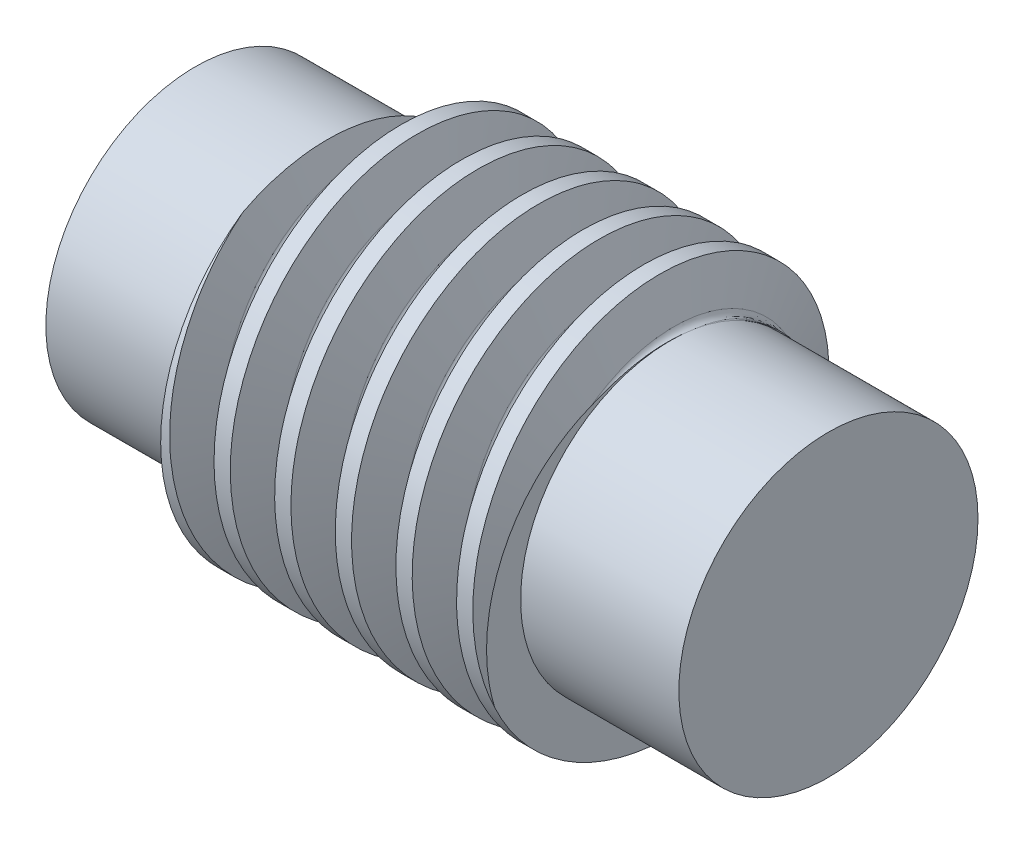
from build123d import *

# Parameters (mm, degrees)
SKETCH_1_W      = 16.4
SKETCH_1_H      = 10
SWEEP_1_PITCH   = 3.141592654
SKETCH_4_R      = 7.75
EXTRUDE_1_DEPTH = 8.2
EXTRUDE_START   = 8.2
SKETCH_5_R      = 7.75
EXTRUDE_2_DEPTH = 8.2


with BuildPart() as part:
    # 草图1 → 旋转1 (revolve)
    with BuildSketch(Plane.XY, mode=Mode.PRIVATE) as revolve_1_sk:
        with Locations((8.2, 5)):
            Rectangle(SKETCH_1_W, SKETCH_1_H)
    revolve(revolve_1_sk.sketch.rotate(Axis((-56.849408284, 0, 0), (1, 0, 0)), 90), axis=Axis((-56.849408284, 0, 0), (1, 0, 0)))

    # 切除-扫描1: the profile of 草图3 profile screwed along a right-hand helix of 10.440564 turns, 10 arcs to a turn; built about Z, then put on its axis
    sweep_1_z = Axis((0, 0, 0), (0, 0, 1))
    sweep_1_corners = [(10.0003, 0, -3.448214384), (10.0003, 0, -1.149259207), (8.000032346, 0, -1.877297093), (7.75, 0, -2.234380289), (7.75, 0, -2.363093301), (8.000032346, 0, -2.720176497)]
    with BuildLine(mode=Mode.PRIVATE) as sweep_1_profile:
        Line(sweep_1_corners[0], sweep_1_corners[1])
        Line(sweep_1_corners[1], sweep_1_corners[2])
        Line(sweep_1_corners[3], sweep_1_corners[4])
        Line(sweep_1_corners[5], sweep_1_corners[0])
        ThreePointArc((8.000032346, 0, -1.877297093), (7.818722223, 0, -2.016421243), (7.75, 0, -2.234380289))
        ThreePointArc((7.75, 0, -2.363093301), (7.818722223, 0, -2.581052347), (8.000032346, 0, -2.720176497))
    sweep_1_cap = Face(sweep_1_profile.wire())
    sweep_1_arcs = [((8.000032346, 0, -1.877297093), (7.75, 0, -1.968301425), (7.75, 0, -2.234380289), (1, 0.8191520442889914, 1)), ((7.75, 0, -2.363093301), (7.75, 0, -2.629172166), (8.000032346, 0, -2.720176497), (1, 0.8191520442889898, 1))]  # start, shoulder, end, weights
    sweep_1_turn_angles = [0, 18, 36, 54, 72, 90, 108, 126, 144, 162, 180, 198, 216, 234, 252, 270, 288, 306, 324, 342, 360]
    sweep_1_turn_weights = [1, 0.9510565162951535, 1, 0.9510565162951535, 1, 0.9510565162951535, 1, 0.9510565162951535, 1, 0.9510565162951535, 1, 0.9510565162951535, 1, 0.9510565162951535, 1, 0.9510565162951535, 1, 0.9510565162951535, 1, 0.9510565162951535, 1]
    sweep_1_turn_rails = [Edge.make_bspline([Vector(p[0], p[1], 0).rotate(sweep_1_z, sweep_1_turn_angles[k]) / sweep_1_turn_weights[k] + Vector(0, 0, p[2] + SWEEP_1_PITCH * sweep_1_turn_angles[k] / 360) for k in range(21)], [0, 0, 0, 1, 1, 2, 2, 3, 3, 4, 4, 5, 5, 6, 6, 7, 7, 8, 8, 9, 9, 10, 10, 10], 2, sweep_1_turn_weights) for p in sweep_1_corners]
    sweep_1_turn_sides = [*[Face.make_surface_from_curves(sweep_1_turn_rails[p[0]], sweep_1_turn_rails[p[1]]) for p in [(0, 1), (1, 2), (3, 4), (5, 0)]], *[Face.make_bezier_surface([[Vector(p[j][0], p[j][1], 0).rotate(sweep_1_z, sweep_1_turn_angles[2 * i + k]) / sweep_1_turn_weights[2 * i + k] + Vector(0, 0, p[j][2] + SWEEP_1_PITCH * sweep_1_turn_angles[2 * i + k] / 360) for k in range(3)] for j in range(3)], [[p[3][j] * sweep_1_turn_weights[2 * i + k] for k in range(3)] for j in range(3)]) for p in sweep_1_arcs for i in range(10)]]
    sweep_1_last_angles = [3600, 3618, 3636, 3654, 3672, 3690, 3708, 3726, 3744, 3751.301568029, 3758.603136058]
    sweep_1_last_weights = [1, 0.9510565162951535, 1, 0.9510565162951535, 1, 0.9510565162951535, 1, 0.9510565162951535, 1, 0.9918909648070657, 1]
    sweep_1_last_rails = [Edge.make_bspline([Vector(p[0], p[1], 0).rotate(sweep_1_z, sweep_1_last_angles[k]) / sweep_1_last_weights[k] + Vector(0, 0, p[2] + SWEEP_1_PITCH * sweep_1_last_angles[k] / 360) for k in range(11)], [0, 0, 0, 1, 1, 2, 2, 3, 3, 4, 4, 5, 5, 5], 2, sweep_1_last_weights) for p in sweep_1_corners]
    sweep_1_last_sides = [*[Face.make_surface_from_curves(sweep_1_last_rails[p[0]], sweep_1_last_rails[p[1]]) for p in [(0, 1), (1, 2), (3, 4), (5, 0)]], *[Face.make_bezier_surface([[Vector(p[j][0], p[j][1], 0).rotate(sweep_1_z, sweep_1_last_angles[2 * i + k]) / sweep_1_last_weights[2 * i + k] + Vector(0, 0, p[j][2] + SWEEP_1_PITCH * sweep_1_last_angles[2 * i + k] / 360) for k in range(3)] for j in range(3)], [[p[3][j] * sweep_1_last_weights[2 * i + k] for k in range(3)] for j in range(3)]) for p in sweep_1_arcs for i in range(5)]]
    sweep_1 = Plane(origin=(0, 0, 0), x_dir=(0, 1, 0), z_dir=(1, 0, 0)) * Solid(Shell([*[p.moved(Location((0, 0, SWEEP_1_PITCH * i))) for i in range(10) for p in sweep_1_turn_sides], *sweep_1_last_sides, sweep_1_cap, sweep_1_cap.rotate(sweep_1_z, 3758.603136058).moved(Location((0, 0, SWEEP_1_PITCH * 3758.603136058 / 360)))]))
    add(sweep_1, mode=Mode.SUBTRACT)

    # 草图4 → 凸台-拉伸1 (add)
    with BuildSketch(Plane(origin=(0, 0, 0), x_dir=(0, 0, -1), z_dir=(1, 0, 0))):
        Circle(SKETCH_4_R)
    extrude(amount=-EXTRUDE_1_DEPTH)

    # 草图5 → 凸台-拉伸2 (add)
    with BuildSketch(Plane(origin=(16.4, 0, 0), x_dir=(0, 0, -1), z_dir=(1, 0, 0)).offset(EXTRUDE_START)):
        Circle(SKETCH_5_R)
    extrude(amount=-EXTRUDE_2_DEPTH)


solid = part.part
